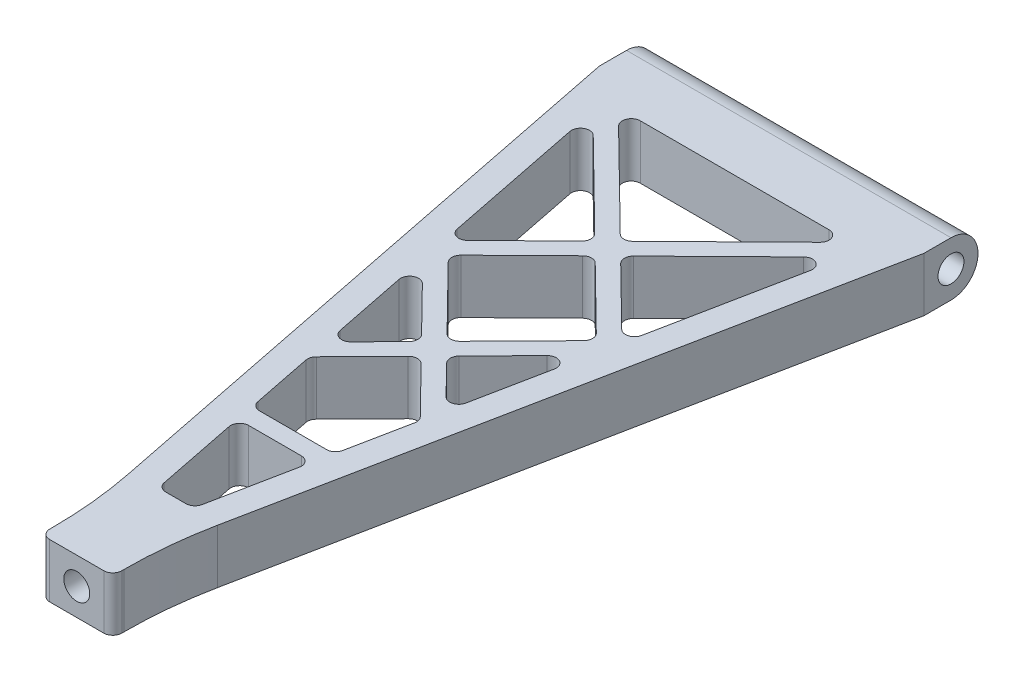
from build123d import *

# Parameters (mm, degrees)
BOSS_EXTRUDE1_DEPTH     = 9.525
CUT_EXTRUDE2_DEPTH      = 139.148989433
CUT_EXTRUDE2_DEPTH_BACK = 139.148989433
SKETCH6_R               = 2.286
SKETCH7_R               = 2.286
CUT_EXTRUDE3_DEPTH      = 12.7
FILLET3_R               = 76.2
FILLET4_R               = 1.5875
FILLET5_R               = 4.7625
CUT_EXTRUDE4_DEPTH      = 129.978879691
CUT_EXTRUDE4_DEPTH_BACK = 129.978879691
FILLET6_R               = 1.5875


with BuildPart() as part:
    # Sketch1 → Boss-Extrude1 (new body)
    with BuildSketch(Plane(origin=(0, 0, 0), x_dir=(1, 0, 0), z_dir=(0, 1, 0))):
        Polygon((-28.575, 4.7625), (-28.575, -4.7625), (-6.35, -115.8875), (-6.35, -125.4125), (6.35, -125.4125), (6.35, -115.8875), (28.575, -4.7625), (28.575, 4.7625), align=None)
    extrude(amount=BOSS_EXTRUDE1_DEPTH)

    # Sketch6 → Cut-Extrude2 (cut, two sides: drawn at the far end of the back side and taken through both)
    with BuildSketch(Plane.ZY.offset(28.575).offset(-CUT_EXTRUDE2_DEPTH_BACK)):
        with Locations((0, 4.7625)):
            Circle(SKETCH6_R)
    extrude(amount=CUT_EXTRUDE2_DEPTH + CUT_EXTRUDE2_DEPTH_BACK, mode=Mode.SUBTRACT)

    # Sketch7 → Cut-Extrude3 (cut)
    with BuildSketch(Plane.XY.offset(125.4125)):
        with Locations((0, 4.7625)):
            Circle(SKETCH7_R)
    extrude(amount=-CUT_EXTRUDE3_DEPTH, mode=Mode.SUBTRACT)

    # Fillet3
    fillet3_edges = [part.edges().sort_by_distance(p)[0] for p in [
        (6.35, 4.7625, 115.8875),
        (-6.35, 4.7625, 115.8875),
    ]]
    fillet(fillet3_edges, radius=FILLET3_R)

    # Fillet4
    fillet4_edges = [part.edges().sort_by_distance(p)[0] for p in [
        (6.35, 4.7625, 125.4125),
        (-6.35, 4.7625, 125.4125),
    ]]
    fillet(fillet4_edges, radius=FILLET4_R)

    # Fillet5
    fillet5_edges = [part.edges().sort_by_distance(p)[0] for p in [
        (0, 0, -4.7625),
        (0, 9.525, -4.7625),
    ]]
    fillet(fillet5_edges, radius=FILLET5_R - 0.0001)  # a hair under: the kernel refuses the full size

    # Sketch8 → Cut-Extrude4 (cut, two sides: drawn at the far end of the back side and taken through both)
    with BuildSketch(Plane(origin=(0, 9.525, 0), x_dir=(1, 0, 0), z_dir=(0, 1, 0)).offset(-CUT_EXTRUDE4_DEPTH_BACK)):
        with BuildLine():
            ThreePointArc((-3.159737044, -107.554734345), (-3.120475766, -107.752318634), (-3.081706229, -107.95))
            Line((-3.081706229, -107.95), (3.081706229, -107.95))
            ThreePointArc((3.081706229, -107.95), (3.120475766, -107.752318634), (3.159737044, -107.554734345))
            Line((3.159737044, -107.554734345), (6.573183913, -90.4875))
            Line((6.573183913, -90.4875), (-6.573183913, -90.4875))
            Line((-6.573183913, -90.4875), (-3.159737044, -107.554734345))
        make_face()
        Polygon((0, -64.734965609), (-9.740127938, -74.652779875), (-7.208183913, -87.3125), (7.208183913, -87.3125), (9.740127938, -74.652779875), align=None)
        Polygon((10.493050249, -70.888168322), (14.721754664, -49.744646246), (2.225043776, -62.469331006), align=None)
        Polygon((-2.225043776, -62.469331006), (-14.721754664, -49.744646246), (-10.493050249, -70.888168322), align=None)
        Polygon((13.045786034, -46.919919878), (0, -34.107860525), (-13.045786034, -46.919919878), (0, -60.203696402), align=None)
        Polygon((-2.265634604, -31.882816749), (-22.211903335, -12.29390289), (-15.662709625, -45.03987144), align=None)
        Polygon((20.50004931, -9.525), (-20.50004931, -9.525), (0, -29.657772974), align=None)
        Polygon((15.662709625, -45.03987144), (22.211903335, -12.29390289), (2.265634604, -31.882816749), align=None)
    extrude(amount=CUT_EXTRUDE4_DEPTH + CUT_EXTRUDE4_DEPTH_BACK, mode=Mode.SUBTRACT)

    # Fillet6
    fillet6_edges = [part.edges().sort_by_distance(p)[0] for p in [
        (3.081706229, 4.7625, 107.95),
        (-3.081706229, 4.7625, 107.95),
        (-6.573183913, 4.7625, 90.4875),
        (6.573183913, 4.7625, 90.4875),
        (-15.662709625, 4.7625, 45.03987144),
        (-22.211903335, 4.7625, 12.29390289),
        (-2.265634604, 4.7625, 31.882816749),
        (2.265634604, 4.7625, 31.882816749),
        (22.211903335, 4.7625, 12.29390289),
        (15.662709625, 4.7625, 45.03987144),
        (10.493050249, 4.7625, 70.888168322),
        (2.225043776, 4.7625, 62.469331006),
        (14.721754664, 4.7625, 49.744646246),
        (9.740127938, 4.7625, 74.652779875),
        (7.208183913, 4.7625, 87.3125),
        (-7.208183913, 4.7625, 87.3125),
        (-9.740127938, 4.7625, 74.652779875),
        (13.045786034, 4.7625, 46.919919878),
        (0, 4.7625, 60.203696402),
        (-13.045786034, 4.7625, 46.919919878),
        (0, 4.7625, 34.107860525),
        (-2.225043776, 4.7625, 62.469331006),
        (-10.493050249, 4.7625, 70.888168322),
        (-14.721754664, 4.7625, 49.744646246),
        (20.50004931, 4.7625, 9.525),
        (0, 4.7625, 29.657772974),
        (-20.50004931, 4.7625, 9.525),
        (0, 4.7625, 64.734965609),
    ]]
    fillet(fillet6_edges, radius=FILLET6_R)


solid = part.part
